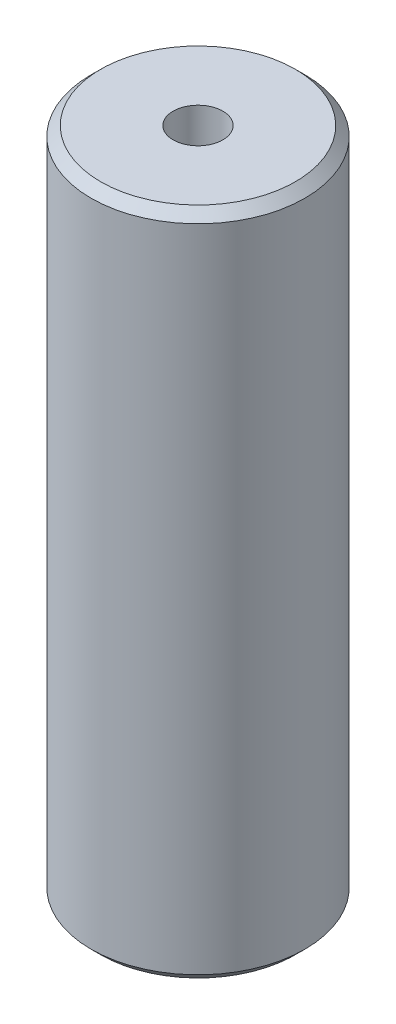
from build123d import *

# Parameters (mm, degrees)
SKETCH1_R           = 5
BOSS_EXTRUDE1_DEPTH = 31.302199411
SKETCH2_R           = 1.164396009
CUT_EXTRUDE1_DEPTH  = 33.090928437
CHAMFER1_SIZE       = 0.445045804


with BuildPart() as part:
    # Sketch1 → Boss-Extrude1 (new body)
    with BuildSketch(Plane(origin=(0, 0, 0), x_dir=(1, 0, 0), z_dir=(0, 1, 0))):
        Circle(SKETCH1_R)
    extrude(amount=BOSS_EXTRUDE1_DEPTH)

    # Sketch2 → Cut-Extrude1 (cut, through all)
    with BuildSketch(Plane(origin=(0, 0, 0), x_dir=(1, 0, 0), z_dir=(0, 1, 0))):
        Circle(SKETCH2_R)
    extrude(amount=CUT_EXTRUDE1_DEPTH, mode=Mode.SUBTRACT)

    # Chamfer1
    chamfer1_edges = [part.edges().sort_by_distance(p)[0] for p in [
        (-5, 31.302199411, 0),
        (-5, 0, 0),
    ]]
    chamfer(chamfer1_edges, length=CHAMFER1_SIZE)


solid = part.part
